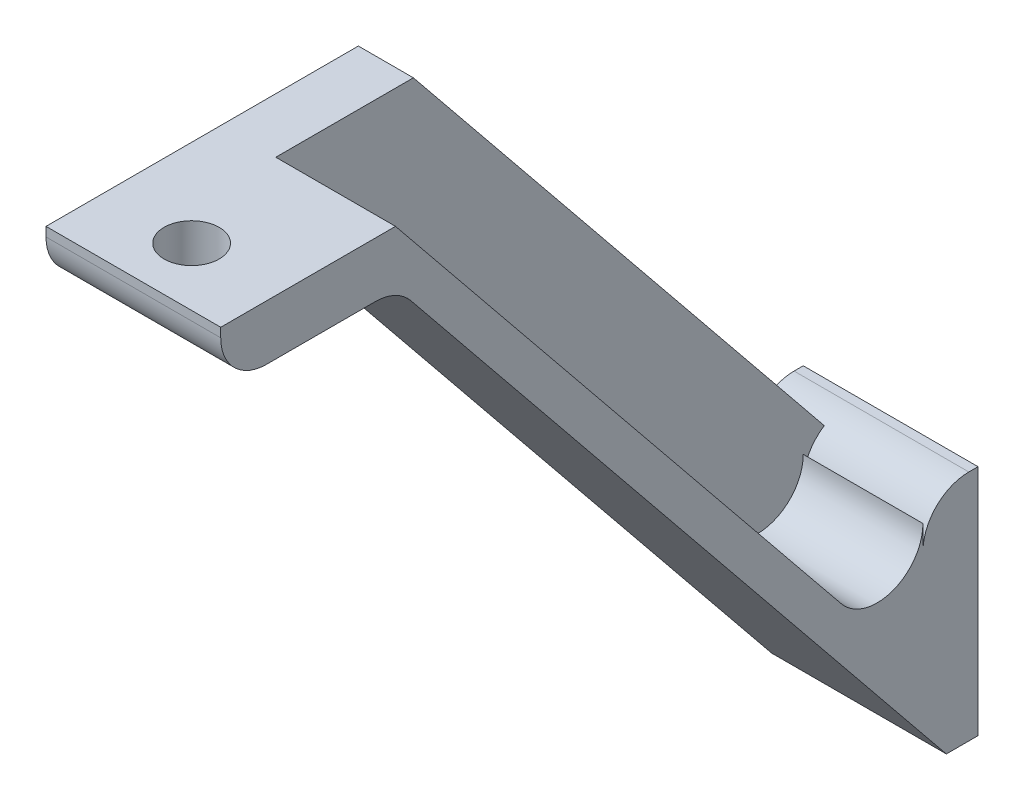
from build123d import *

# Parameters (mm, degrees)
BOSS_EXTRUDE2_DEPTH = 19.05
SKETCH3_R           = 3
CUT_EXTRUDE1_DEPTH  = 19.05
SKETCH4_W           = 6
SKETCH4_H           = 88.387555127
BOSS_EXTRUDE3_DEPTH = 15
SKETCH5_W           = 11.265279665
SKETCH5_H           = 13.66791861
CUT_EXTRUDE2_DEPTH  = 25


with BuildPart() as part:
    # Sketch1 → Boss-Extrude2 (new body)
    with BuildSketch(Plane(origin=(0, 0, 0), x_dir=(0, 0, -1), z_dir=(1, 0, 0))):
        with BuildLine():
            Line((31.306445994, -28.563533752), (-17.310044053, 31.386343612))
            Line((-17.310044053, 31.386343612), (-36.360044053, 31.386343612))
            Line((-36.360044053, 31.386343612), (-36.360044053, 30.386343612))
            ThreePointArc((-36.360044053, 30.386343612), (-34.895577959, 26.850809706), (-31.360044053, 25.386343612))
            Line((-31.360044053, 25.386343612), (-19.521151885, 25.386343612))
            ThreePointArc((-19.521151885, 25.386343612), (-17.370187724, 24.900028712), (-15.637641932, 23.535684884))
            Line((-15.637641932, 23.535684884), (42.740340563, -48.45126621))
            Line((42.740340563, -48.45126621), (46.189955947, -48.45126621))
            Line((46.189955947, -48.45126621), (46.189955947, -23.05126621))
            Line((46.189955947, -23.05126621), (45.189955947, -23.05126621))
            ThreePointArc((45.189955947, -23.05126621), (41.654422041, -24.515732305), (40.189955947, -28.05126621))
            Line((40.189955947, -28.05126621), (40.189955947, -25.41419248))
            ThreePointArc((40.189955947, -25.41419248), (36.860651945, -30.126811167), (31.306445994, -28.563533752))
        make_face()
    extrude(amount=BOSS_EXTRUDE2_DEPTH)

    # Sketch3 → Cut-Extrude1 (cut)
    with BuildSketch(Plane(origin=(0, 31.386343612, 0), x_dir=(1, 0, 0), z_dir=(0, 1, 0))):
        with Locations((9.525, -30.010044053)):
            Circle(SKETCH3_R)
    extrude(amount=-CUT_EXTRUDE1_DEPTH, mode=Mode.SUBTRACT)

    # Sketch4 → Boss-Extrude3 (add, along a direction that is not the sketch's normal)
    with BuildSketch(Plane(origin=(0, 3.983611716, -4.912264), x_dir=(-1, 0, 0), z_dir=(0, 0.6298682542524827, -0.7767019906533842))):
        with Locations((-3, -8.912894772)):
            Rectangle(SKETCH4_W, SKETCH4_H)
    extrude(amount=BOSS_EXTRUDE3_DEPTH, dir=(0, 0, -1))

    # Sketch5 → Cut-Extrude2 (cut)
    with BuildSketch(Plane(origin=(19.05, 0, 0), x_dir=(0, 0, -1), z_dir=(1, 0, 0))):
        with Locations((51.82259578, -32.7543507)):
            Rectangle(SKETCH5_W, SKETCH5_H)
    extrude(amount=-CUT_EXTRUDE2_DEPTH, mode=Mode.SUBTRACT)


solid = part.part
